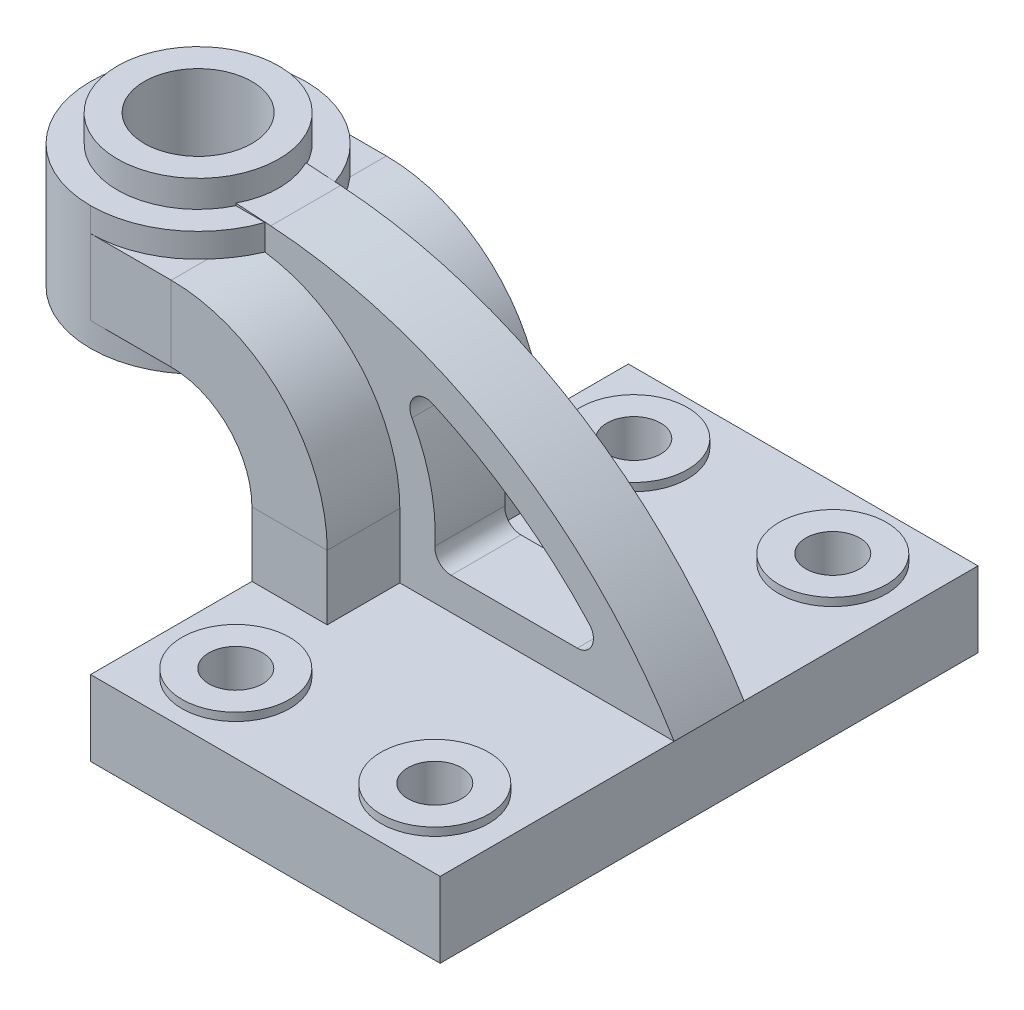
from build123d import *

# Parameters (mm, degrees)
SKETCH1_W            = 65
SKETCH1_H            = 100
SKETCH1_R            = 10
BOSS_EXTRUDE1_DEPTH  = 14
SKETCH1_4_R          = 10
SKETCH1_4_R_2        = 5
BOSS_EXTRUDE3_DEPTH  = 1.5
SKETCH1_8_R          = 10
SKETCH1_8_R_2        = 5
BOSS_EXTRUDE6_DEPTH  = 14
SKETCH5_W            = 14
SKETCH5_H            = 40
SKETCH8_R            = 20
BOSS_EXTRUDE8_DEPTH  = 11.5
SKETCH11_R           = 15
BOSS_EXTRUDE10_DEPTH = 5
CUT_EXTRUDE1_REACH   = 118.045
SKETCH12_R           = 10
RIB1_START           = -6.5
RIB1_DEPTH           = 13
CUT_EXTRUDE2_DEPTH   = 15


# Read off the part's stored shape, not the designer's step: Rib1
with BuildPart() as part:
    # Sketch1 → Boss-Extrude1 (new body)
    with BuildSketch(Plane(origin=(0, 0, 0), x_dir=(1, 0, 0), z_dir=(0, 1, 0))):
        Rectangle(SKETCH1_W, SKETCH1_H)
        with Locations(Location((-18.5, 37, 0), (0, 0, 270))):
            Circle(SKETCH1_R, mode=Mode.SUBTRACT)
        with Locations(Location((18.5, -37, 0), (0, 0, 270))):
            Circle(SKETCH1_R, mode=Mode.SUBTRACT)
        with Locations(Location((-18.5, -37, 0), (0, 0, 270))):
            Circle(SKETCH1_R, mode=Mode.SUBTRACT)
        with Locations(Location((18.5, 37, 0), (0, 0, 270))):
            Circle(SKETCH1_R, mode=Mode.SUBTRACT)
    extrude(amount=-BOSS_EXTRUDE1_DEPTH)

    # Sketch1<4> → Boss-Extrude3 (add, symmetric)
    # profile 1 of 4: a face of its own
    with BuildSketch(Plane(origin=(0, 0, 0), x_dir=(1, 0, 0), z_dir=(0, 1, 0))):
        with Locations(Location((18.5, -37, 0), (0, 0, 270))):
            Circle(SKETCH1_4_R)
        with Locations(Location((18.5, -37, 0), (0, 0, 270))):
            Circle(SKETCH1_4_R_2, mode=Mode.SUBTRACT)
    # profile 2 of 4: a face of its own
    with BuildSketch(Plane(origin=(0, 0, 0), x_dir=(1, 0, 0), z_dir=(0, 1, 0))):
        with Locations(Location((-18.5, -37, 0), (0, 0, 270))):
            Circle(SKETCH1_4_R)
        with Locations(Location((-18.5, -37, 0), (0, 0, 270))):
            Circle(SKETCH1_4_R_2, mode=Mode.SUBTRACT)
    # profile 3 of 4: a face of its own
    with BuildSketch(Plane(origin=(0, 0, 0), x_dir=(1, 0, 0), z_dir=(0, 1, 0))):
        with Locations(Location((-18.5, 37, 0), (0, 0, 270))):
            Circle(SKETCH1_4_R)
        with Locations(Location((-18.5, 37, 0), (0, 0, 270))):
            Circle(SKETCH1_4_R_2, mode=Mode.SUBTRACT)
    # profile 4 of 4: a face of its own
    with BuildSketch(Plane(origin=(0, 0, 0), x_dir=(1, 0, 0), z_dir=(0, 1, 0))):
        with Locations(Location((18.5, 37, 0), (0, 0, 270))):
            Circle(SKETCH1_4_R)
        with Locations(Location((18.5, 37, 0), (0, 0, 270))):
            Circle(SKETCH1_4_R_2, mode=Mode.SUBTRACT)
    extrude(amount=BOSS_EXTRUDE3_DEPTH, both=True)

    # Sketch1<8> → Boss-Extrude6 (add)
    # profile 1 of 4: a face of its own
    with BuildSketch(Plane(origin=(0, 0, 0), x_dir=(1, 0, 0), z_dir=(0, 1, 0))):
        with Locations(Location((18.5, -37, 0), (0, 0, 270))):
            Circle(SKETCH1_8_R)
        with Locations(Location((18.5, -37, 0), (0, 0, 270))):
            Circle(SKETCH1_8_R_2, mode=Mode.SUBTRACT)
    # profile 2 of 4: a face of its own
    with BuildSketch(Plane(origin=(0, 0, 0), x_dir=(1, 0, 0), z_dir=(0, 1, 0))):
        with Locations(Location((-18.5, -37, 0), (0, 0, 270))):
            Circle(SKETCH1_8_R)
        with Locations(Location((-18.5, -37, 0), (0, 0, 270))):
            Circle(SKETCH1_8_R_2, mode=Mode.SUBTRACT)
    # profile 3 of 4: a face of its own
    with BuildSketch(Plane(origin=(0, 0, 0), x_dir=(1, 0, 0), z_dir=(0, 1, 0))):
        with Locations(Location((-18.5, 37, 0), (0, 0, 270))):
            Circle(SKETCH1_8_R)
        with Locations(Location((-18.5, 37, 0), (0, 0, 270))):
            Circle(SKETCH1_8_R_2, mode=Mode.SUBTRACT)
    # profile 4 of 4: a face of its own
    with BuildSketch(Plane(origin=(0, 0, 0), x_dir=(1, 0, 0), z_dir=(0, 1, 0))):
        with Locations(Location((18.5, 37, 0), (0, 0, 270))):
            Circle(SKETCH1_8_R)
        with Locations(Location((18.5, 37, 0), (0, 0, 270))):
            Circle(SKETCH1_8_R_2, mode=Mode.SUBTRACT)
    extrude(amount=-BOSS_EXTRUDE6_DEPTH)

    # Sweep1: sweep along a path in Sketch6
    with BuildLine(Plane.XY) as sweep1_path:
        Line((-32.5, 0), (-32.5, 12))
        ThreePointArc((-32.5, 12), (-36.893398282, 22.606601718), (-47.5, 27))
        Line((-47.5, 27), (-62.5, 27))
    # Sketch5 → Sweep1 (sweep)
    with BuildSketch(Plane(origin=(0, 0, 0), x_dir=(1, 0, 0), z_dir=(0, 1, 0))):
        with Locations((-25.5, 0)):
            Rectangle(SKETCH5_W, SKETCH5_H)
    sweep(path=sweep1_path.line)

    # Sketch8 → Boss-Extrude8 (add, symmetric)
    with BuildSketch(Plane(origin=(0, 34, 0), x_dir=(1, 0, 0), z_dir=(0, 1, 0))):
        with Locations(Location((-62.5, 0, 0), (0, 0, 270))):
            Circle(SKETCH8_R)
    extrude(amount=BOSS_EXTRUDE8_DEPTH, both=True)

    # Sketch11 → Boss-Extrude10 (add)
    with BuildSketch(Plane(origin=(0, 45.5, 0), x_dir=(1, 0, 0), z_dir=(0, 1, 0))):
        with Locations(Location((-62.5, 0, 0), (0, 0, 270))):
            Circle(SKETCH11_R)
    extrude(amount=BOSS_EXTRUDE10_DEPTH)

    # Sketch12 → Cut-Extrude1 (cut, up to next)
    with BuildSketch(Plane(origin=(0, 50.5, 0), x_dir=(1, 0, 0), z_dir=(0, 1, 0)), mode=Mode.PRIVATE) as cut_extrude1_sk1:
        with Locations(Location((-62.5, 0, 0), (0, 0, 270))):
            Circle(SKETCH12_R)
    cut_extrude1_tool1 = extrude(cut_extrude1_sk1.sketch, amount=-CUT_EXTRUDE1_REACH, mode=Mode.PRIVATE) & part.part
    add(cut_extrude1_tool1.solids().sort_by_distance((-62.5, 50.5, 0))[0], mode=Mode.SUBTRACT)

    # Rib1 outline → Rib1 (add)
    with BuildSketch(Plane.XY.offset(RIB1_START)):
        with BuildLine():
            Line((-50, 45.991191737), (-50, 41))
            Line((-50, 41), (-47.5, 41))
            ThreePointArc((-47.5, 41), (-26.993903346, 32.506096654), (-18.5, 12))
            Line((-18.5, 12), (-18.5, 0))
            Line((-18.5, 0), (32.5, 0))
            ThreePointArc((32.5, 0), (0.566198386, 31.925052284), (-42.5, 45.5))
            Line((-42.5, 45.5), (-48.981494165, 45.924487517))
            Line((-48.981494165, 45.924487517), (-50, 45.991191737))
        make_face()
    extrude(amount=RIB1_DEPTH)

    # Sketch14 → Cut-Extrude2 (cut, symmetric)
    with BuildSketch(Plane.XY):
        with BuildLine():
            Line((14.495933603, 6), (-8.980084126, 6))
            ThreePointArc((-8.980084126, 6), (-11.161205142, 6.940215761), (-11.975176588, 9.171525926))
            ThreePointArc((-11.975176588, 9.171525926), (-12.786554884, 18.744648632), (-16.243500658, 27.708606407))
            ThreePointArc((-16.243500658, 27.708606407), (-15.839776142, 31.196285594), (-12.402605555, 31.912356784))
            ThreePointArc((-12.402605555, 31.912356784), (3.209342465, 22.95318127), (16.699316747, 11.035952535))
            ThreePointArc((16.699316747, 11.035952535), (17.244374762, 7.797472995), (14.495933603, 6))
        make_face()
    extrude(amount=CUT_EXTRUDE2_DEPTH, both=True, mode=Mode.SUBTRACT)


solid = part.part
